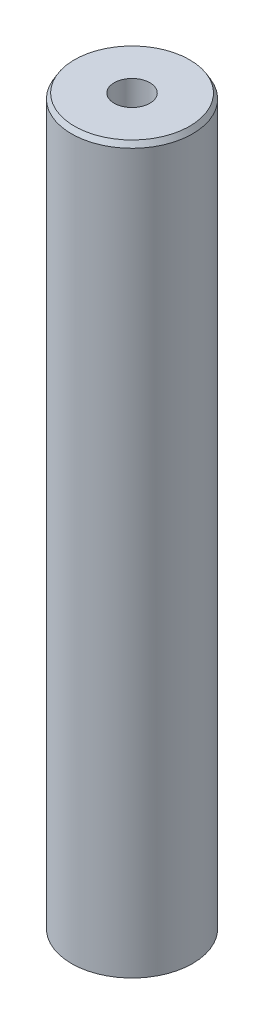
from build123d import *
from OCP.BRepFilletAPI import BRepFilletAPI_MakeChamfer

# Parameters (mm, degrees)
SKETCH1_R           = 50
BOSS_EXTRUDE1_DEPTH = 600
SKETCH2_R           = 14.729349145
CUT_EXTRUDE1_DEPTH  = 605.15229868
CHAMFER1_SIZE       = 4.218057824
CHAMFER1_SIZE2      = 2.43529682


with BuildPart() as part:
    # Sketch1 → Boss-Extrude1 (new body)
    with BuildSketch(Plane(origin=(0, 0, 0), x_dir=(1, 0, 0), z_dir=(0, 1, 0))):
        Circle(SKETCH1_R)
    extrude(amount=BOSS_EXTRUDE1_DEPTH)

    # Sketch2 → Cut-Extrude1 (cut, through all)
    with BuildSketch(Plane(origin=(0, 0, 0), x_dir=(1, 0, 0), z_dir=(0, 1, 0))):
        Circle(SKETCH2_R)
    extrude(amount=CUT_EXTRUDE1_DEPTH, mode=Mode.SUBTRACT)

    # Chamfer1: one chamfer whose edges measure the first distance from different faces: ONE call of the kernel's chamfer builder (chamfer() names one face for all edges)
    chamfer1_edges_1 = [part.edges().sort_by_distance(p)[0] for p in [
        (-50, 600, 0),
    ]]
    chamfer1_side_1 = [part.faces().sort_by_distance(p)[0] for p in [
        (-50, 300, 0),
    ]]
    chamfer1_edges_2 = [part.edges().sort_by_distance(p)[0] for p in [
        (-50, 0, 0),
    ]]
    chamfer1_side_2 = [part.faces().sort_by_distance(p)[0] for p in [
        (-48.585786438, 0, 0),
    ]]
    chamfer1 = BRepFilletAPI_MakeChamfer(part.part.solid().wrapped)
    for e in chamfer1_edges_1:
        chamfer1.Add(CHAMFER1_SIZE, CHAMFER1_SIZE2, e.wrapped, chamfer1_side_1[0].wrapped)  # the first distance lies on this face
    for e in chamfer1_edges_2:
        chamfer1.Add(CHAMFER1_SIZE, CHAMFER1_SIZE2, e.wrapped, chamfer1_side_2[0].wrapped)  # the first distance lies on this face
    add(Compound.cast(chamfer1.Shape()), mode=Mode.REPLACE)


solid = part.part
